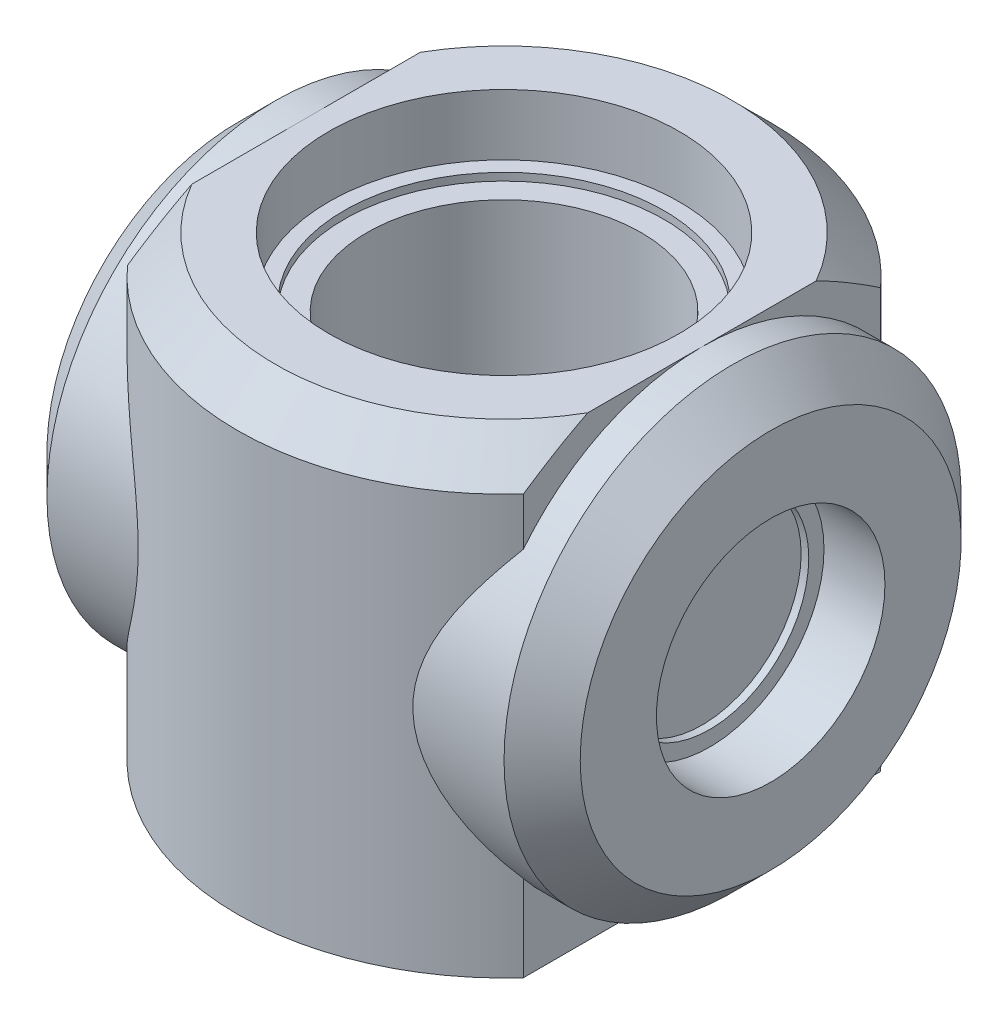
from build123d import *

# Parameters (mm, degrees)
BOSS_EXTRUDE1_DEPTH = 15
CHAMFER1_SIZE       = 2.5


with BuildPart() as part:
    # Sketch3 → Revolve1 (revolve)
    with BuildSketch(Plane(origin=(0, 0, 0), x_dir=(1, 0, 0), z_dir=(0, 1, 0))):
        Polygon((-13, 6.5), (-13, 0), (0, 0), (0, 15), (-17.5, 15), (-17.5, 7.5), (-13.5, 7.5), (-13.5, 6.5), align=None)
    revolve1 = revolve(axis=Axis((0, 0, 0), (-1, 0, 0)))

    # Mirror1: Revolve1 across plane
    add(revolve1.mirror(Plane(origin=(0, 0, 0), x_dir=(0, 0, 1), z_dir=(1, 0, 0))))

    # Sketch6 → Boss-Extrude1 (add, symmetric)
    with BuildSketch(Plane(origin=(0, 0, 0), x_dir=(1, 0, 0), z_dir=(0, 1, 0))):
        with BuildLine():
            ThreePointArc((12.993588105, 11.722485579), (0, 17.5), (-12.993588105, 11.722485579))
            Line((-12.993588105, 11.722485579), (-12.993588105, -11.722485579))
            ThreePointArc((-12.993588105, -11.722485579), (0, -17.5), (12.993588105, -11.722485579))
            Line((12.993588105, -11.722485579), (12.993588105, 11.722485579))
        make_face()
    extrude(amount=BOSS_EXTRUDE1_DEPTH, both=True)

    # Sketch8 → Cut-Revolve1 (revolve, cut)
    with BuildSketch(Plane.XY):
        Polygon((0, -15), (11.5, -15), (11.5, -11), (10.5, -11), (10.5, -10.5), (9, -10.5), (9, 10.5), (10.5, 10.5), (10.5, 11), (11.5, 11), (11.5, 15), (0, 15), align=None)
    revolve(axis=Axis((0, 15, 0), (0, -1, 0)), mode=Mode.SUBTRACT)

    # Chamfer1
    chamfer1_edges = [part.edges().sort_by_distance(p)[0] for p in [
        (17.5, 0, 15),
        (-17.5, 0, 15),
        (0, 15, -17.5),
        (0, 15, 17.5),
    ]]
    chamfer(chamfer1_edges, length=CHAMFER1_SIZE)


solid = part.part
